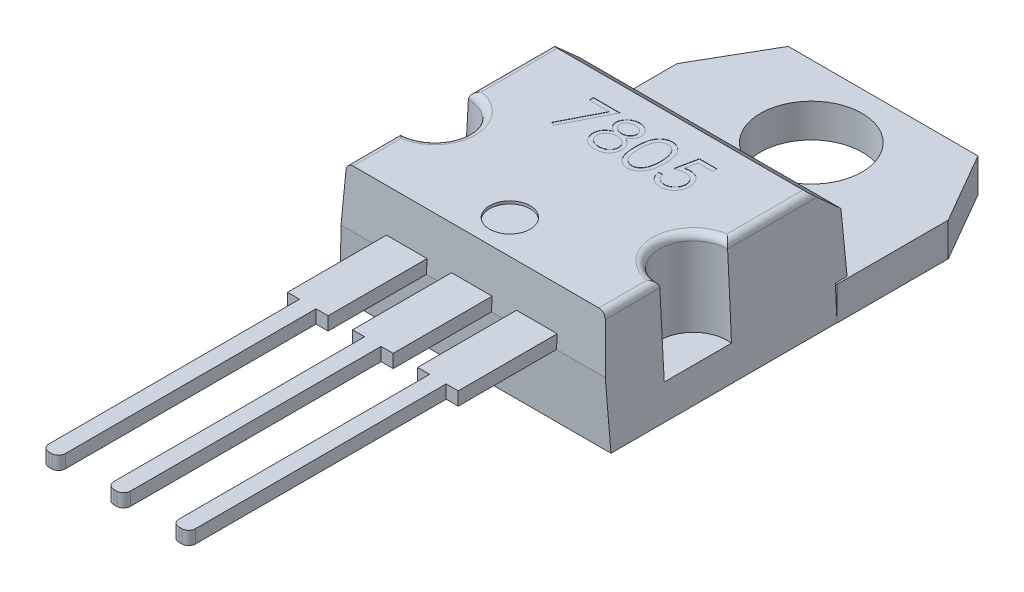
from build123d import *

# Parameters (mm, degrees)
SKETCH1_W                       = 10
SKETCH1_H                       = 9.05
BOSS_EXTRUDE1_DEPTH             = 4.4
BOSS_EXTRUDE1_TAPER             = 3
CHAMFER2_SIZE                   = 1
CHAMFER2_SIZE2                  = 1.056754503
SKETCH2_R                       = 1.25
CUT_EXTRUDE1_DEPTH              = 3.17
FILLET1_R                       = 0.25
SKETCH3_R                       = 0.75
CUT_EXTRUDE2_DEPTH              = 0.1
CHAMFER3_SIZE                   = 2.4
CHAMFER3_SIZE_2                 = 0.209301283
SKETCH5_W                       = 1.5
SKETCH5_H                       = 0.49
BOSS_EXTRUDE3_DEPTH             = 3.5
BOSS_EXTRUDE3_DIRECTION_2_REACH = 16.187
LPATTERN2_COUNT                 = 3
LPATTERN2_PITCH                 = 2.4
SKETCH6_W                       = 0.305
SKETCH6_H                       = 0.49
BOSS_EXTRUDE4_DEPTH             = 9.5
LPATTERN4_COUNT                 = 3
LPATTERN4_PITCH                 = 2.4
FILLET2_R                       = 0.25
FILLET3_R                       = 0.25
FILLET4_R                       = 0.25
BOSS_EXTRUDE5_DEPTH             = 0.01
BOSS_EXTRUDE5_DEPTH_BACK        = 1.23
SKETCH7_R                       = 1.875
CHAMFER6_SIZE                   = 1.5
CHAMFER6_SIZE2                  = 2.598076211
CHAMFER7_SIZE                   = 1.5
CHAMFER7_SIZE2                  = 2.598076211
CUT_EXTRUDE3_DEPTH              = 0.01


with BuildPart() as part:
    # Sketch1 → Boss-Extrude1 (new body)
    with BuildSketch(Plane(origin=(0, 0, 0), x_dir=(1, 0, 0), z_dir=(0, 1, 0))):
        with Locations((5, 4.525)):
            Rectangle(SKETCH1_W, SKETCH1_H)
    extrude(amount=BOSS_EXTRUDE1_DEPTH, taper=BOSS_EXTRUDE1_TAPER)

    # Chamfer2
    chamfer2_edges = [part.edges().sort_by_distance(p)[0] for p in [
        (5, 4.4, -8.819405771),
    ]]
    chamfer2_side = [part.faces().sort_by_distance(p)[0] for p in [
        (5, 2.182690612, -8.935610032),
    ]]
    chamfer(chamfer2_edges, length=CHAMFER2_SIZE, length2=CHAMFER2_SIZE2, reference=chamfer2_side[0])

    # Sketch2 → Cut-Extrude1 (cut)
    with BuildSketch(Plane(origin=(0, 4.4, 0), x_dir=(1, 0, 0), z_dir=(0, 1, 0))):
        with Locations((0.230594229, 3.480594229)):
            Circle(SKETCH2_R)
        with Locations((9.769405771, 3.480594229)):
            Circle(SKETCH2_R)
    extrude(amount=-CUT_EXTRUDE1_DEPTH, mode=Mode.SUBTRACT)

    # Fillet1
    fillet1_edges = [part.edges().sort_by_distance(p)[0] for p in [
        (9.769405771, 4.4, -6.246622749),
        (8.519405771, 4.4, -3.480594229),
        (9.769405771, 4.4, -1.230594229),
        (0.230594229, 4.4, -1.230594229),
        (1.480594229, 4.4, -3.480594229),
        (0.230594229, 4.4, -6.246622749),
    ]]
    fillet(fillet1_edges, radius=FILLET1_R)

    # Sketch3 → Cut-Extrude2 (cut)
    with BuildSketch(Plane(origin=(0, 4.4, 0), x_dir=(1, 0, 0), z_dir=(0, 1, 0))):
        with Locations(Location((5, 1.480594229, 0), (0, 0, 270))):
            Circle(SKETCH3_R)
    extrude(amount=-CUT_EXTRUDE2_DEPTH, mode=Mode.SUBTRACT)

    # Chamfer3
    # the kernel refuses this chamfer: 2.4, 0.209301283 mm, written as the material it takes off along each edge
    with BuildSketch(Plane(origin=(-6.239121792, 0, 0), x_dir=(0, 0.9987993847780049, -0.04898764096258241), z_dir=(1, 0, 0))) as chamfer3_piece_1:
        Polygon((CHAMFER3_SIZE * 0.999994379968, -CHAMFER3_SIZE * 0.00335261579403), (CHAMFER3_SIZE_2 * 0.0489876410284, -CHAMFER3_SIZE_2 * 0.998799386119), (0, 0), align=None)
    extrude(amount=22.478243583, mode=Mode.SUBTRACT)


with BuildPart() as body_2:
    # Sketch5 → Boss-Extrude3 (new body)
    with BuildSketch(Plane.XY):
        with Locations((2.525, 2.641710883)):
            Rectangle(SKETCH5_W, SKETCH5_H)
    boss_extrude3 = extrude(amount=BOSS_EXTRUDE3_DEPTH)


    # Sketch5 → Boss-Extrude3 direction 2 (add, up to next)
    with BuildSketch(Plane.XY, mode=Mode.PRIVATE) as boss_extrude3_direction_2_sk1:
        with Locations((2.525, 2.641710883)):
            Rectangle(SKETCH5_W, SKETCH5_H)
    boss_extrude3_direction_2_tool1 = extrude(boss_extrude3_direction_2_sk1.sketch, amount=-BOSS_EXTRUDE3_DIRECTION_2_REACH, mode=Mode.PRIVATE) - part.part
    boss_extrude3_direction_2 = boss_extrude3_direction_2_tool1.solids().sort_by_distance((2.525, 2.641711, 0))[0]
    add(boss_extrude3_direction_2)

    # Sketch6 → Boss-Extrude4 (add)
    with BuildSketch(Plane.XY.offset(3.5)):
        with Locations((2.6775, 2.641710883)):
            Rectangle(SKETCH6_W, SKETCH6_H)
        with Locations((2.3725, 2.641710883)):
            Rectangle(SKETCH6_W, SKETCH6_H)
    boss_extrude4 = extrude(amount=BOSS_EXTRUDE4_DEPTH)

    # Fillet2
    fillet2_edges = [body_2.edges().sort_by_distance(p)[0] for p in [
        (2.22, 2.641710883, 13),
        (2.83, 2.641710883, 13),
    ]]
    fillet(fillet2_edges, radius=FILLET2_R)


with BuildPart() as lpattern2_1:
    # LPattern2: Boss-Extrude3, Boss-Extrude3 direction 2 ×3
    with Locations(*[(i * LPATTERN2_PITCH, 0, 0) for i in range(1, LPATTERN2_COUNT)]):
        add(boss_extrude3)
        add(boss_extrude3_direction_2)

    # LPattern4: Boss-Extrude4 ×3
    with Locations(*[(i * LPATTERN4_PITCH, 0, 0) for i in range(1, LPATTERN4_COUNT)]):
        add(boss_extrude4)

    # Fillet3
    fillet3_edges = [lpattern2_1.edges().sort_by_distance(p)[0] for p in [
        (5.23, 2.641710883, 13),
        (4.62, 2.641710883, 13),
    ]]
    fillet(fillet3_edges, radius=FILLET3_R)

    # Fillet4
    fillet4_edges = [lpattern2_1.edges().sort_by_distance(p)[0] for p in [
        (7.63, 2.641710883, 13),
        (7.02, 2.641710883, 13),
    ]]
    fillet(fillet4_edges, radius=FILLET4_R)


with BuildPart() as part_1:
    add(part.part)

    # Sketch7 → Boss-Extrude5 (add, two sides: drawn at the far end of the back side and taken through both)
    with BuildSketch(Plane.XZ.offset(-BOSS_EXTRUDE5_DEPTH_BACK)):
        Polygon((1, -2.709301283), (9, -2.709301283), (9, -8.55), (10, -8.55), (10, -9.05), (10, -15.25), (0, -15.25), (0, -9.05), (0, -8.55), (1, -8.55), align=None)
        with Locations(Location((5, -12.6, 0), (0, 0, 90))):
            Circle(SKETCH7_R, mode=Mode.SUBTRACT)
    extrude(amount=BOSS_EXTRUDE5_DEPTH + BOSS_EXTRUDE5_DEPTH_BACK)

    # Chamfer6
    chamfer6_edges = [part_1.edges().sort_by_distance(p)[0] for p in [
        (0, 0.61, -15.25),
    ]]
    chamfer6_side = [part_1.faces().sort_by_distance(p)[0] for p in [
        (5, 0.61, -15.25),
    ]]
    chamfer(chamfer6_edges, length=CHAMFER6_SIZE, length2=CHAMFER6_SIZE2, reference=chamfer6_side[0])

    # Chamfer7
    chamfer7_edges = [part_1.edges().sort_by_distance(p)[0] for p in [
        (10, 0.61, -15.25),
    ]]
    chamfer7_side = [part_1.faces().sort_by_distance(p)[0] for p in [
        (5.75, 0.61, -15.25),
    ]]
    chamfer(chamfer7_edges, length=CHAMFER7_SIZE, length2=CHAMFER7_SIZE2, reference=chamfer7_side[0])

    # Sketch8 → Cut-Extrude3 (cut)
    # profile 1 of 4: a face of its own
    with BuildSketch(Plane(origin=(0, 4.4, 0), x_dir=(1, 0, 0), z_dir=(0, 1, 0))):
        Polygon((2.7137233, 6.85194735), (3.690646377, 6.85194735), (2.856191249, 5.223742222), (2.733121838, 5.291478099), (3.449595696, 6.689126837), (2.7137233, 6.689126837), align=None)
    # profile 2 of 4: a face of its own
    with BuildSketch(Plane(origin=(0, 4.4, 0), x_dir=(1, 0, 0), z_dir=(0, 1, 0))):
        with BuildLine():
            add(Edge.make_bspline(
                [(4.604921717, 6.148829862), (4.61791588, 6.142054432), (4.643258836, 6.128840081), (4.679352784, 6.10756267), (4.712338767, 6.08513766), (4.743131986, 6.062624253), (4.771191435, 6.039160254), (4.796203365, 6.014652358), (4.818785607, 5.989712304), (4.838482755, 5.96391777), (4.855807749, 5.937337282), (4.87078111, 5.909901076), (4.883579627, 5.881669278), (4.893722817, 5.852333716), (4.902078416, 5.822325312), (4.907827708, 5.791256584), (4.910919667, 5.759332258), (4.911504236, 5.737756636), (4.911800223, 5.726832166)],
                knots=[0, 0, 0, 0, 1.272397273, 2.481599622, 3.635517121, 4.734568067, 5.792894095, 6.808321871, 7.773003508, 8.711915296, 9.623354172, 10.525449501, 11.423591555, 12.311487226, 13.218079475, 14.126165749, 15.051214107, 16, 16, 16, 16], degree=3))
            add(Edge.make_bspline(
                [(4.911800223, 5.726832166), (4.911450329, 5.711547837), (4.910757757, 5.681294415), (4.904725264, 5.636642072), (4.895693306, 5.5932753), (4.88250367, 5.551203605), (4.865397953, 5.51065914), (4.844317388, 5.471607196), (4.820454449, 5.433407724), (4.80129004, 5.409903924), (4.791592891, 5.398011052)],
                knots=[0, 0, 0, 0, 1.025265484, 2.029385089, 3.018602448, 3.995076438, 4.983346944, 5.966715145, 6.97116228, 8, 8, 8, 8], degree=3))
            add(Edge.make_bspline(
                [(4.791592891, 5.398011052), (4.778967062, 5.38413459), (4.753871424, 5.356553142), (4.710880596, 5.32074331), (4.663699242, 5.29064912), (4.612509926, 5.266123654), (4.557449484, 5.247034711), (4.498529646, 5.233317569), (4.435635548, 5.22546061), (4.39240771, 5.224324872), (4.370231213, 5.223742222)],
                knots=[0, 0, 0, 0, 0.954267603, 1.896743057, 2.838368354, 3.796610408, 4.779680527, 5.799409237, 6.871065594, 8, 8, 8, 8], degree=3))
            add(Edge.make_bspline(
                [(4.370231213, 5.223742222), (4.348907283, 5.224264953), (4.307413081, 5.225282134), (4.247016473, 5.232173894), (4.190717794, 5.244251534), (4.138189702, 5.260781767), (4.089748866, 5.282285692), (4.045533316, 5.309050221), (4.004905122, 5.339998053), (3.969097257, 5.37601801), (3.937307141, 5.414597831), (3.909381632, 5.454399454), (3.886170532, 5.495426513), (3.866518599, 5.537067258), (3.851474532, 5.579905335), (3.841054993, 5.623720341), (3.834437697, 5.668435745), (3.833557254, 5.698612602), (3.833114326, 5.713793804)],
                knots=[0, 0, 0, 0, 1.256902934, 2.445805442, 3.576955095, 4.645999104, 5.686449165, 6.692658513, 7.68621702, 8.689161843, 9.678783111, 10.630372946, 11.551080876, 12.453998257, 13.34127905, 14.221779781, 15.105423033, 16, 16, 16, 16], degree=3))
            add(Edge.make_bspline(
                [(3.833114326, 5.713793804), (3.833376436, 5.724933152), (3.833894458, 5.746948435), (3.837479872, 5.779473738), (3.843244067, 5.81113127), (3.851072463, 5.842037965), (3.861681964, 5.871968813), (3.874491789, 5.901065635), (3.889428782, 5.92936128), (3.90670131, 5.957010487), (3.926795443, 5.983625837), (3.949548241, 6.00965902), (3.975414453, 6.034706082), (4.004106319, 6.059073039), (4.03529595, 6.083192141), (4.069793473, 6.105759918), (4.106684373, 6.128374066), (4.132903253, 6.141894271), (4.146353007, 6.148829862)],
                knots=[0, 0, 0, 0, 0.941657376, 1.861047343, 2.762797495, 3.66048619, 4.553285746, 5.444104102, 6.34607688, 7.256116206, 8.197091036, 9.162375105, 10.176350973, 11.237807142, 12.343728897, 13.50695164, 14.721116704, 16, 16, 16, 16], degree=3))
            add(Edge.make_bspline(
                [(4.146353007, 6.148829862), (4.12794192, 6.158869561), (4.0922929, 6.178309227), (4.045089975, 6.214026529), (4.004544943, 6.252710645), (3.971772267, 6.295178444), (3.945976649, 6.340103277), (3.928278925, 6.387204063), (3.916306234, 6.435607443), (3.915120223, 6.46867561), (3.914524582, 6.485283187)],
                knots=[0, 0, 0, 0, 1.166880483, 2.259407225, 3.286803203, 4.280235371, 5.237608625, 6.161067461, 7.076446754, 8, 8, 8, 8], degree=3))
            add(Edge.make_bspline(
                [(3.914524582, 6.485283187), (3.915266364, 6.502200294), (3.916757474, 6.536206629), (3.928814909, 6.586827978), (3.948463653, 6.63654692), (3.975188534, 6.685122475), (4.008474879, 6.730910608), (4.048410276, 6.771977395), (4.094041057, 6.807950817), (4.145139447, 6.838147867), (4.200128739, 6.862724027), (4.258147657, 6.879677811), (4.318185316, 6.890761336), (4.359051068, 6.892016211), (4.379771477, 6.892652478)],
                knots=[0, 0, 0, 0, 0.888701115, 1.786444228, 2.72001202, 3.692817113, 4.693886446, 5.687152267, 6.695133018, 7.739871481, 8.800368666, 9.853104506, 10.91144658, 12, 12, 12, 12], degree=3))
            add(Edge.make_bspline(
                [(4.379771477, 6.892652478), (4.399957136, 6.891996458), (4.439760956, 6.890702862), (4.498269233, 6.879913813), (4.554251231, 6.861893638), (4.607513897, 6.837447398), (4.657103708, 6.807336178), (4.700919756, 6.770868639), (4.739624177, 6.729983007), (4.771639241, 6.684208758), (4.798020266, 6.635819856), (4.816390318, 6.58519107), (4.828161392, 6.533416318), (4.829646096, 6.498383367), (4.830389967, 6.480831064)],
                knots=[0, 0, 0, 0, 1.072916533, 2.115669174, 3.151510826, 4.193348718, 5.225979165, 6.227137561, 7.216255879, 8.211077061, 9.189680878, 10.138522389, 11.067357538, 12, 12, 12, 12], degree=3))
            add(Edge.make_bspline(
                [(4.830389967, 6.480831064), (4.829739291, 6.463605934), (4.828461401, 6.429776759), (4.817711785, 6.380461515), (4.799608247, 6.334277948), (4.774891251, 6.290702002), (4.74267612, 6.250523965), (4.703392873, 6.213232923), (4.657354702, 6.178522541), (4.622764943, 6.15893444), (4.604921717, 6.148829862)],
                knots=[0, 0, 0, 0, 0.975232327, 1.915300861, 2.843280834, 3.77672583, 4.742871857, 5.749627742, 6.839139064, 8, 8, 8, 8], degree=3))
        make_face()
        with BuildLine():
            add(Edge.make_bspline(
                [(4.371821257, 6.729831965), (4.360685713, 6.729536491), (4.338899719, 6.728958413), (4.306955286, 6.725938245), (4.276578534, 6.720063036), (4.247452082, 6.712244049), (4.219975263, 6.701681283), (4.193774912, 6.689255689), (4.169296936, 6.67414901), (4.146245845, 6.657203038), (4.125494601, 6.63856447), (4.107077537, 6.61914539), (4.091779428, 6.598564409), (4.078788639, 6.577333474), (4.069362736, 6.554822463), (4.062303213, 6.531721536), (4.05753101, 6.507738773), (4.057173419, 6.491348284), (4.056992531, 6.483057126)],
                knots=[0, 0, 0, 0, 1.203892937, 2.355340988, 3.463153438, 4.544400666, 5.610487187, 6.640501085, 7.674077295, 8.714426146, 9.728707835, 10.68524104, 11.601827946, 12.495867327, 13.368432065, 14.231010473, 15.105153427, 16, 16, 16, 16], degree=3))
            add(Edge.make_bspline(
                [(4.056992531, 6.483057126), (4.057304301, 6.474765609), (4.057920403, 6.45838038), (4.062685229, 6.43418422), (4.069786731, 6.410407263), (4.080967567, 6.387614886), (4.094378022, 6.365016433), (4.110929513, 6.343176703), (4.130654893, 6.322019689), (4.15289234, 6.301725343), (4.177118287, 6.282721261), (4.202783192, 6.266223425), (4.229564949, 6.252419382), (4.257188387, 6.240930688), (4.28593504, 6.231999895), (4.315628762, 6.225664116), (4.346274543, 6.22172621), (4.367039307, 6.221255847), (4.377545415, 6.221017863)],
                knots=[0, 0, 0, 0, 0.873023192, 1.725219244, 2.590779336, 3.480155217, 4.391973325, 5.357036234, 6.360879153, 7.436073238, 8.526419356, 9.601555421, 10.645666583, 11.697338044, 12.750135903, 13.812665442, 14.89329948, 16, 16, 16, 16], degree=3))
            add(Edge.make_bspline(
                [(4.377545415, 6.221017863), (4.391039212, 6.22141377), (4.417893529, 6.222201675), (4.45748094, 6.229527386), (4.495972211, 6.241050785), (4.532955929, 6.256816912), (4.567474794, 6.276605263), (4.598245111, 6.300296667), (4.625004416, 6.327344083), (4.647474621, 6.357326441), (4.66489623, 6.389235911), (4.678458836, 6.421258187), (4.686378744, 6.453734913), (4.687411783, 6.475491357), (4.687922018, 6.486237214)],
                knots=[0, 0, 0, 0, 1.076279235, 2.141928126, 3.20205304, 4.278698113, 5.344010996, 6.36967002, 7.368914609, 8.37248503, 9.349703398, 10.264243087, 11.142681841, 12, 12, 12, 12], degree=3))
            add(Edge.make_bspline(
                [(4.687922018, 6.486237214), (4.687680764, 6.493779216), (4.687201911, 6.508749009), (4.683255814, 6.530855339), (4.676735347, 6.552458757), (4.66790745, 6.57373773), (4.656291579, 6.594393705), (4.642519251, 6.614751391), (4.625789495, 6.634352827), (4.607013255, 6.653654808), (4.585720159, 6.671518276), (4.561951242, 6.687227591), (4.535828362, 6.700568195), (4.507350903, 6.711403452), (4.476623741, 6.719541589), (4.443788401, 6.725635932), (4.408571098, 6.729070879), (4.38433689, 6.729572768), (4.371821257, 6.729831965)],
                knots=[0, 0, 0, 0, 0.814439003, 1.616544685, 2.417341072, 3.248991801, 4.09997495, 4.973547432, 5.9003056, 6.880240646, 7.880314356, 8.896779544, 9.951930927, 11.043077905, 12.18215768, 13.381699519, 14.647792085, 16, 16, 16, 16], degree=3))
        make_face(mode=Mode.SUBTRACT)
        with BuildLine():
            add(Edge.make_bspline(
                [(4.381043512, 6.05819735), (4.366925745, 6.057946234), (4.339230131, 6.057453606), (4.298655024, 6.051970154), (4.259714482, 6.044336822), (4.222539796, 6.032756763), (4.187146666, 6.017699784), (4.153343493, 5.999586617), (4.121388873, 5.978175577), (4.091724065, 5.953738684), (4.064635269, 5.927404574), (4.040868897, 5.899527106), (4.020686094, 5.870624385), (4.004433155, 5.840329339), (3.991092833, 5.809283458), (3.98233261, 5.776713584), (3.97671662, 5.743245858), (3.975962498, 5.720494671), (3.975582274, 5.709023672)],
                knots=[0, 0, 0, 0, 1.140299081, 2.23698856, 3.303958914, 4.344563908, 5.37730929, 6.408454204, 7.439741482, 8.480804886, 9.510774543, 10.48932336, 11.43758569, 12.353841022, 13.263987381, 14.161954604, 15.073269652, 16, 16, 16, 16], degree=3))
            add(Edge.make_bspline(
                [(3.975582274, 5.709023672), (3.97620061, 5.694767511), (3.977427372, 5.666483621), (3.987159491, 5.624681085), (4.002778466, 5.584212964), (4.024561331, 5.545409042), (4.051534123, 5.509145958), (4.0847022, 5.477537121), (4.122004294, 5.449451307), (4.164702535, 5.426736208), (4.211342589, 5.408595685), (4.261912052, 5.396097087), (4.315685176, 5.387823287), (4.352814348, 5.38698954), (4.371821257, 5.386562735)],
                knots=[0, 0, 0, 0, 0.898778495, 1.783155532, 2.693654817, 3.627872908, 4.583023416, 5.533784346, 6.509005473, 7.520592997, 8.575161974, 9.658835044, 10.801527049, 12, 12, 12, 12], degree=3))
            add(Edge.make_bspline(
                [(4.371821257, 5.386562735), (4.386675888, 5.386847944), (4.415617473, 5.387403624), (4.4578386, 5.392308679), (4.497682377, 5.400087258), (4.535071539, 5.411400938), (4.570424638, 5.425212178), (4.603142266, 5.442979514), (4.634066098, 5.463187175), (4.661672325, 5.487162125), (4.686815245, 5.51277961), (4.708737846, 5.539898665), (4.727768592, 5.567782256), (4.742705133, 5.597060511), (4.754645969, 5.627171719), (4.763229153, 5.65839354), (4.768525151, 5.690821735), (4.769060771, 5.712819528), (4.769332274, 5.723970086)],
                knots=[0, 0, 0, 0, 1.224942928, 2.386581632, 3.501229538, 4.569074225, 5.605009692, 6.626002462, 7.634866581, 8.645888296, 9.63523824, 10.59253846, 11.518950513, 12.414518923, 13.29783783, 14.186679152, 15.080837789, 16, 16, 16, 16], degree=3))
            add(Edge.make_bspline(
                [(4.769332274, 5.723970086), (4.768921407, 5.734800166), (4.768111249, 5.756155191), (4.76296925, 5.787799294), (4.753935977, 5.818371285), (4.741541051, 5.848238966), (4.725039686, 5.876797161), (4.705606477, 5.904789853), (4.682159501, 5.931440098), (4.655665217, 5.956954895), (4.626791331, 5.980547747), (4.596099447, 6.001418582), (4.563825816, 6.018995434), (4.530038731, 6.033290416), (4.494813215, 6.044533304), (4.458175176, 6.052387345), (4.420081719, 6.057331093), (4.39420326, 6.057905336), (4.381043512, 6.05819735)],
                knots=[0, 0, 0, 0, 0.917430815, 1.809013306, 2.70690318, 3.612392954, 4.541220862, 5.495268465, 6.494511384, 7.542276156, 8.608045339, 9.649016899, 10.681629292, 11.715607085, 12.752076957, 13.808767841, 14.885711793, 16, 16, 16, 16], degree=3))
        make_face(mode=Mode.SUBTRACT)
    # profile 3 of 4: a face of its own
    with BuildSketch(Plane(origin=(0, 4.4, 0), x_dir=(1, 0, 0), z_dir=(0, 1, 0))):
        with BuildLine():
            add(Edge.make_bspline(
                [(5.054268172, 6.057561332), (5.054416951, 6.083005505), (5.054705958, 6.132431176), (5.057921063, 6.204451353), (5.063262022, 6.272015484), (5.070581473, 6.335126803), (5.0794887, 6.393801604), (5.091379296, 6.447883083), (5.104901531, 6.497621547), (5.120573534, 6.543179191), (5.138257281, 6.585169792), (5.157504249, 6.624369794), (5.179078281, 6.660719884), (5.20174638, 6.694800239), (5.226426142, 6.726052987), (5.252415236, 6.75491948), (5.280728015, 6.78073257), (5.310402023, 6.804248572), (5.341705919, 6.824863154), (5.373747414, 6.84302086), (5.406747051, 6.858532943), (5.440794927, 6.870729676), (5.475585016, 6.880803882), (5.511238935, 6.887693154), (5.547815554, 6.892027895), (5.572504098, 6.892442308), (5.585024882, 6.892652478)],
                knots=[0, 0, 0, 0, 1.646270934, 3.197905019, 4.663502075, 6.030701355, 7.308322542, 8.50163776, 9.611534131, 10.641858119, 11.616356847, 12.558055219, 13.465016945, 14.349605745, 15.204443733, 16.039544428, 16.859896111, 17.680448484, 18.487036065, 19.28249412, 20.06191084, 20.843045899, 21.620316918, 22.403196591, 23.190181807, 24, 24, 24, 24], degree=3))
            add(Edge.make_bspline(
                [(5.585024882, 6.892652478), (5.59765026, 6.892431219), (5.622758164, 6.891991205), (5.65987862, 6.887762131), (5.696141512, 6.880744871), (5.731392239, 6.870802143), (5.765920358, 6.858466962), (5.7994558, 6.843006019), (5.832206869, 6.825008819), (5.863653106, 6.80386156), (5.894139735, 6.780283885), (5.922917919, 6.753630817), (5.949990275, 6.72417148), (5.975696575, 6.692221063), (5.999307506, 6.657166757), (6.021792599, 6.61961825), (6.041918486, 6.578918893), (6.061301714, 6.535747753), (6.078032597, 6.488910307), (6.093121216, 6.438670577), (6.105312748, 6.384435142), (6.115467882, 6.326488559), (6.123335031, 6.264618022), (6.129064837, 6.198956158), (6.132091558, 6.129459766), (6.132661561, 6.081944599), (6.132954069, 6.057561332)],
                knots=[0, 0, 0, 0, 0.810914788, 1.612654377, 2.396697861, 3.181598691, 3.963628158, 4.749916497, 5.551656086, 6.361998678, 7.18212741, 8.025565596, 8.878627764, 9.750805457, 10.657531673, 11.591944965, 12.560506719, 13.57287815, 14.630710178, 15.753379473, 16.941251878, 18.199788006, 19.531962791, 20.947069417, 22.433333509, 24, 24, 24, 24], degree=3))
            add(Edge.make_bspline(
                [(6.132954069, 6.057561332), (6.132658529, 6.033284417), (6.132082681, 5.985981837), (6.129098768, 5.916798145), (6.123221103, 5.851484747), (6.115868715, 5.789885001), (6.1056856, 5.732255296), (6.093164685, 5.678396206), (6.079262575, 5.628075145), (6.062101793, 5.581704356), (6.043319078, 5.538636967), (6.022883328, 5.498420082), (6.000989514, 5.460698228), (5.977136762, 5.425773343), (5.951712535, 5.393398023), (5.924172681, 5.364143744), (5.895293523, 5.337305618), (5.864717177, 5.313424344), (5.832780509, 5.292521594), (5.800141928, 5.273828169), (5.766222322, 5.258754768), (5.731790376, 5.245812088), (5.696353581, 5.235924026), (5.659956111, 5.229086956), (5.622783104, 5.224291868), (5.597654537, 5.223926071), (5.585024882, 5.223742222)],
                knots=[0, 0, 0, 0, 1.561518951, 3.042555995, 4.452378317, 5.7783523, 7.031515105, 8.214008947, 9.334062868, 10.386615937, 11.391082383, 12.354592575, 13.286541444, 14.194233754, 15.072674879, 15.931287219, 16.775624067, 17.606195743, 18.42308326, 19.229000347, 20.022332153, 20.807536673, 21.593273796, 22.3848459, 23.188221202, 24, 24, 24, 24], degree=3))
            add(Edge.make_bspline(
                [(5.585024882, 5.223742222), (5.572504445, 5.223953747), (5.547816586, 5.224370834), (5.511234951, 5.228685991), (5.475728271, 5.235623594), (5.441121336, 5.245337554), (5.407236595, 5.257227855), (5.374535779, 5.27271899), (5.342655294, 5.2905598), (5.311680196, 5.310877723), (5.282192537, 5.334155772), (5.254026384, 5.359902432), (5.227889322, 5.388760193), (5.203562428, 5.420273394), (5.180442038, 5.454152115), (5.159174358, 5.490858912), (5.139502578, 5.530248239), (5.121521423, 5.572574577), (5.105578994, 5.618455563), (5.09149664, 5.668416083), (5.080377719, 5.722897103), (5.07086045, 5.781461052), (5.063184033, 5.844359585), (5.057943322, 5.911626848), (5.054704225, 5.983220925), (5.054416175, 6.032329002), (5.054268172, 6.057561332)],
                knots=[0, 0, 0, 0, 0.810891512, 1.598919785, 2.382837074, 3.152667961, 3.926044502, 4.706494248, 5.493654104, 6.291793342, 7.103789334, 7.925228297, 8.761435821, 9.622817696, 10.50288917, 11.416980706, 12.369136599, 13.353924996, 14.394355917, 15.514179734, 16.714354668, 17.994756427, 19.357759367, 20.818452758, 22.365282078, 24, 24, 24, 24], degree=3))
        make_face()
        with BuildLine():
            add(Edge.make_bspline(
                [(5.19673612, 6.05819735), (5.196790298, 6.036993476), (5.196895447, 5.99584092), (5.199642366, 5.936040584), (5.203384436, 5.880264756), (5.208211024, 5.828442616), (5.21537879, 5.780749575), (5.223410083, 5.736857611), (5.233183681, 5.696999007), (5.244747493, 5.66090025), (5.257918797, 5.627948709), (5.272299671, 5.597286729), (5.287748642, 5.568552101), (5.305038399, 5.542002928), (5.323868446, 5.517552632), (5.34381346, 5.494768455), (5.365617811, 5.474449824), (5.395782008, 5.450080858), (5.43560398, 5.424898965), (5.485778258, 5.40297056), (5.53733502, 5.389189946), (5.572328623, 5.387437456), (5.589795015, 5.386562735)],
                knots=[0, 0, 0, 0, 1.459021318, 2.831673884, 4.118529203, 5.306027144, 6.411944654, 7.436330062, 8.375795394, 9.233974572, 10.042671642, 10.816086306, 11.563610507, 12.285937304, 12.993564865, 13.685989202, 14.367179055, 15.041617293, 16.353048772, 17.594441528, 18.799311195, 20, 20, 20, 20], degree=3))
            add(Edge.make_bspline(
                [(5.589795015, 5.386562735), (5.607374387, 5.387287442), (5.642496837, 5.388735362), (5.693811094, 5.402704789), (5.743626967, 5.423782044), (5.78266674, 5.448704663), (5.812367751, 5.472439298), (5.833647957, 5.492675228), (5.853179672, 5.515333782), (5.87170447, 5.539780962), (5.888694836, 5.566483839), (5.904144902, 5.595314007), (5.918243421, 5.626351527), (5.926275738, 5.648018516), (5.930382455, 5.659096288)],
                knots=[0, 0, 0, 0, 1.353760809, 2.704726607, 4.075137775, 5.516104923, 6.260822281, 7.007110065, 7.778089737, 8.566572457, 9.372053459, 10.217411131, 11.088608312, 12, 12, 12, 12], degree=3))
            add(Edge.make_bspline(
                [(5.930382455, 5.659096288), (5.935168435, 5.673261206), (5.944886028, 5.702022063), (5.95740994, 5.746637005), (5.967273031, 5.79344683), (5.976146415, 5.842171794), (5.98220298, 5.89317123), (5.987077881, 5.94628734), (5.9899493, 6.001560172), (5.99030524, 6.039113614), (5.99048612, 6.05819735)],
                knots=[0, 0, 0, 0, 0.884706709, 1.796334032, 2.740027952, 3.714592787, 4.726048262, 5.777819803, 6.87074269, 8, 8, 8, 8], degree=3))
            add(Edge.make_bspline(
                [(5.99048612, 6.05819735), (5.99023657, 6.077277999), (5.989748397, 6.114603827), (5.98788241, 6.169267431), (5.98306386, 6.221186736), (5.977712117, 6.270585415), (5.969821234, 6.317190017), (5.961313229, 6.361390691), (5.949882679, 6.402639849), (5.937672638, 6.441583302), (5.923697923, 6.477778599), (5.908314715, 6.511394495), (5.89188556, 6.54259328), (5.874041044, 6.571289357), (5.854993002, 6.597611261), (5.834238685, 6.621031238), (5.812601345, 6.642275148), (5.782294978, 6.666524242), (5.74261914, 6.69124919), (5.693249864, 6.714002945), (5.641873536, 6.727069563), (5.607142005, 6.728911829), (5.589795015, 6.729831965)],
                knots=[0, 0, 0, 0, 1.31362396, 2.569729283, 3.763502607, 4.902122613, 5.988968491, 7.01645872, 7.998833611, 8.933434873, 9.825090667, 10.667526885, 11.477055099, 12.250526234, 12.991942729, 13.710640831, 14.402115721, 15.076753259, 16.378508321, 17.609869233, 18.806226677, 20, 20, 20, 20], degree=3))
            add(Edge.make_bspline(
                [(5.589795015, 6.729831965), (5.572236996, 6.728910559), (5.537088973, 6.727066068), (5.48517865, 6.714051628), (5.435419891, 6.691367176), (5.39584897, 6.66644235), (5.365521467, 6.642703187), (5.344166102, 6.622117188), (5.32414266, 6.599599066), (5.305696953, 6.574923912), (5.288420743, 6.548405691), (5.272554355, 6.519835787), (5.258258994, 6.489069419), (5.24506708, 6.456132678), (5.233467994, 6.420037036), (5.223900375, 6.380227528), (5.215061604, 6.33647517), (5.208804464, 6.288523821), (5.203241975, 6.236688702), (5.199667221, 6.180773633), (5.196886258, 6.120873003), (5.196787169, 6.07950767), (5.19673612, 6.05819735)],
                knots=[0, 0, 0, 0, 1.207732386, 2.417664972, 3.655092373, 4.956220595, 5.625982001, 6.301752483, 6.994047911, 7.697131622, 8.419323945, 9.170223765, 9.943494443, 10.752040957, 11.610060368, 12.549350801, 13.567764191, 14.679664412, 15.874934091, 17.154273443, 18.533957287, 20, 20, 20, 20], degree=3))
        make_face(mode=Mode.SUBTRACT)
    # profile 4 of 4: a face of its own
    with BuildSketch(Plane(origin=(0, 4.4, 0), x_dir=(1, 0, 0), z_dir=(0, 1, 0))):
        with BuildLine():
            Line((7.272697659, 6.85194735), (7.272697659, 6.689126837))
            Line((7.272697659, 6.689126837), (6.732718693, 6.689126837))
            Line((6.732718693, 6.689126837), (6.647174322, 6.271581264))
            add(Edge.make_bspline(
                [(6.647174322, 6.271581264), (6.663981807, 6.276221423), (6.696543653, 6.285210997), (6.744604019, 6.295192186), (6.790229768, 6.301209013), (6.819836811, 6.302030571), (6.834163504, 6.302428119)],
                knots=[0, 0, 0, 0, 1.100273476, 2.13160584, 3.095893838, 4, 4, 4, 4], degree=3))
            add(Edge.make_bspline(
                [(6.834163504, 6.302428119), (6.851890772, 6.302044427), (6.886747009, 6.301289992), (6.937746103, 6.294045618), (6.986429237, 6.282642871), (7.032694598, 6.266713205), (7.076627776, 6.246343433), (7.117824563, 6.220898103), (7.15690333, 6.191174057), (7.193163007, 6.156999712), (7.226057961, 6.119388836), (7.254980392, 6.078949373), (7.279546995, 6.036074326), (7.299304909, 5.99035405), (7.31508209, 5.942294005), (7.325583173, 5.891388513), (7.332575752, 5.838117401), (7.333356977, 5.801693543), (7.333755351, 5.783119726)],
                knots=[0, 0, 0, 0, 1.052922333, 2.070308379, 3.05430497, 4.020497103, 4.973039431, 5.925935799, 6.892292201, 7.88610001, 8.88166317, 9.857072816, 10.836096531, 11.812156883, 12.81219415, 13.836441305, 14.89672472, 16, 16, 16, 16], degree=3))
            add(Edge.make_bspline(
                [(7.333755351, 5.783119726), (7.333453692, 5.770182862), (7.33285445, 5.744483964), (7.329807091, 5.706318558), (7.32393982, 5.66896113), (7.316062316, 5.632406724), (7.30583772, 5.596724545), (7.293460185, 5.561812459), (7.278312701, 5.527887762), (7.261697755, 5.494629458), (7.242989531, 5.462789421), (7.222225709, 5.433012916), (7.200288504, 5.40485326), (7.176684018, 5.37861246), (7.151192852, 5.354462948), (7.124123725, 5.332261406), (7.095692634, 5.311632374), (7.065459721, 5.293413228), (7.034098666, 5.276647887), (7.001156582, 5.262893997), (6.967383335, 5.250597436), (6.932292838, 5.240795972), (6.895964573, 5.233115849), (6.858338657, 5.227899505), (6.819612425, 5.224100193), (6.793361973, 5.223862359), (6.780102006, 5.223742222)],
                knots=[0, 0, 0, 0, 1.056347294, 2.098418968, 3.122841568, 4.141288669, 5.149314143, 6.15115421, 7.162517403, 8.180376062, 9.185164535, 10.17417709, 11.141909838, 12.097768115, 13.052685741, 14.0056014, 14.954263652, 15.917497458, 16.885230207, 17.854509472, 18.828990115, 19.81800267, 20.826176721, 21.857883937, 22.917946725, 24, 24, 24, 24], degree=3))
            add(Edge.make_bspline(
                [(6.780102006, 5.223742222), (6.764284074, 5.224055566), (6.733164161, 5.224672034), (6.687570904, 5.231121133), (6.643703922, 5.240357623), (6.601916341, 5.25425336), (6.56183366, 5.27166474), (6.523995499, 5.293670289), (6.487435022, 5.31860724), (6.453638491, 5.348035114), (6.422271254, 5.380200442), (6.39419223, 5.415106229), (6.369185215, 5.452176369), (6.347650666, 5.491590889), (6.32928192, 5.533246222), (6.314851551, 5.577298441), (6.303204582, 5.623517371), (6.298277245, 5.655336999), (6.295774582, 5.671498632)],
                knots=[0, 0, 0, 0, 1.0467383, 2.05933395, 3.04377827, 4.011590433, 4.970194871, 5.932262533, 6.905835911, 7.896367577, 8.894135286, 9.877477877, 10.858688626, 11.851381753, 12.8477658, 13.868841284, 14.917554742, 16, 16, 16, 16], degree=3))
            Line((6.295774582, 5.671498632), (6.438242531, 5.671498632))
            add(Edge.make_bspline(
                [(6.438242531, 5.671498632), (6.441747984, 5.656360027), (6.448485659, 5.627262787), (6.463274695, 5.586381786), (6.481356717, 5.549951281), (6.502857975, 5.517489363), (6.528507453, 5.489182425), (6.557776158, 5.463956114), (6.590591018, 5.441198109), (6.62705509, 5.422228497), (6.66552388, 5.40605017), (6.70578615, 5.395277079), (6.746745621, 5.387702031), (6.774449025, 5.386943769), (6.788370235, 5.386562735)],
                knots=[0, 0, 0, 0, 1.136247022, 2.183929868, 3.172523383, 4.106158343, 5.02341133, 5.958108904, 6.928429099, 7.938127109, 8.96079061, 9.975095812, 10.982467395, 12, 12, 12, 12], degree=3))
            add(Edge.make_bspline(
                [(6.788370235, 5.386562735), (6.801958529, 5.386935016), (6.828713992, 5.387668041), (6.868089157, 5.393310022), (6.906104282, 5.401999349), (6.942384262, 5.415003176), (6.97756396, 5.430807744), (7.010753492, 5.451089225), (7.042913011, 5.474430019), (7.073042914, 5.501171062), (7.10063795, 5.530639459), (7.125020191, 5.56215242), (7.14532972, 5.595769704), (7.162444833, 5.630909313), (7.175441151, 5.667956372), (7.184712596, 5.706737263), (7.190156841, 5.747347771), (7.190905769, 5.775047066), (7.191287403, 5.789161893)],
                knots=[0, 0, 0, 0, 1.027316725, 2.022795036, 3.002884548, 3.971462791, 4.93288096, 5.914575861, 6.907176829, 7.935150275, 8.956128384, 9.956726525, 10.942570165, 11.921478529, 12.907843606, 13.90538589, 14.932640048, 16, 16, 16, 16], degree=3))
            add(Edge.make_bspline(
                [(7.191287403, 5.789161893), (7.190988735, 5.801896252), (7.190404136, 5.826821947), (7.18562777, 5.86328873), (7.177319715, 5.897793289), (7.165788169, 5.930502245), (7.151147107, 5.961446449), (7.133255387, 5.990657837), (7.111777238, 6.017751397), (7.087242703, 6.042739805), (7.060364949, 6.065801588), (7.030681537, 6.085461227), (6.998813642, 6.102000218), (6.965145216, 6.116273203), (6.928875423, 6.126524256), (6.890722522, 6.134220404), (6.850274515, 6.138672372), (6.822619953, 6.139290086), (6.80840479, 6.139607606)],
                knots=[0, 0, 0, 0, 1.045622112, 2.046656509, 3.013763289, 3.955457236, 4.890082067, 5.820317437, 6.762574623, 7.722996705, 8.69280354, 9.665887285, 10.63943826, 11.638615906, 12.663482002, 13.728887084, 14.832589034, 16, 16, 16, 16], degree=3))
            add(Edge.make_bspline(
                [(6.80840479, 6.139607606), (6.796099883, 6.139344267), (6.770693372, 6.138800537), (6.731721233, 6.134797091), (6.690767487, 6.128338554), (6.647989127, 6.119454791), (6.603257682, 6.107829267), (6.55666755, 6.093898047), (6.508120772, 6.077241998), (6.475410233, 6.064663458), (6.458595095, 6.05819735)],
                knots=[0, 0, 0, 0, 0.817624296, 1.688186739, 2.600797293, 3.572016777, 4.590301741, 5.671205678, 6.80286297, 8, 8, 8, 8], degree=3))
            Line((6.458595095, 6.05819735), (6.621415608, 6.85194735))
            Line((6.621415608, 6.85194735), (7.272697659, 6.85194735))
        make_face()
    extrude(amount=-CUT_EXTRUDE3_DEPTH, mode=Mode.SUBTRACT)


solid = Compound([body_2.part, lpattern2_1.part, part_1.part])
